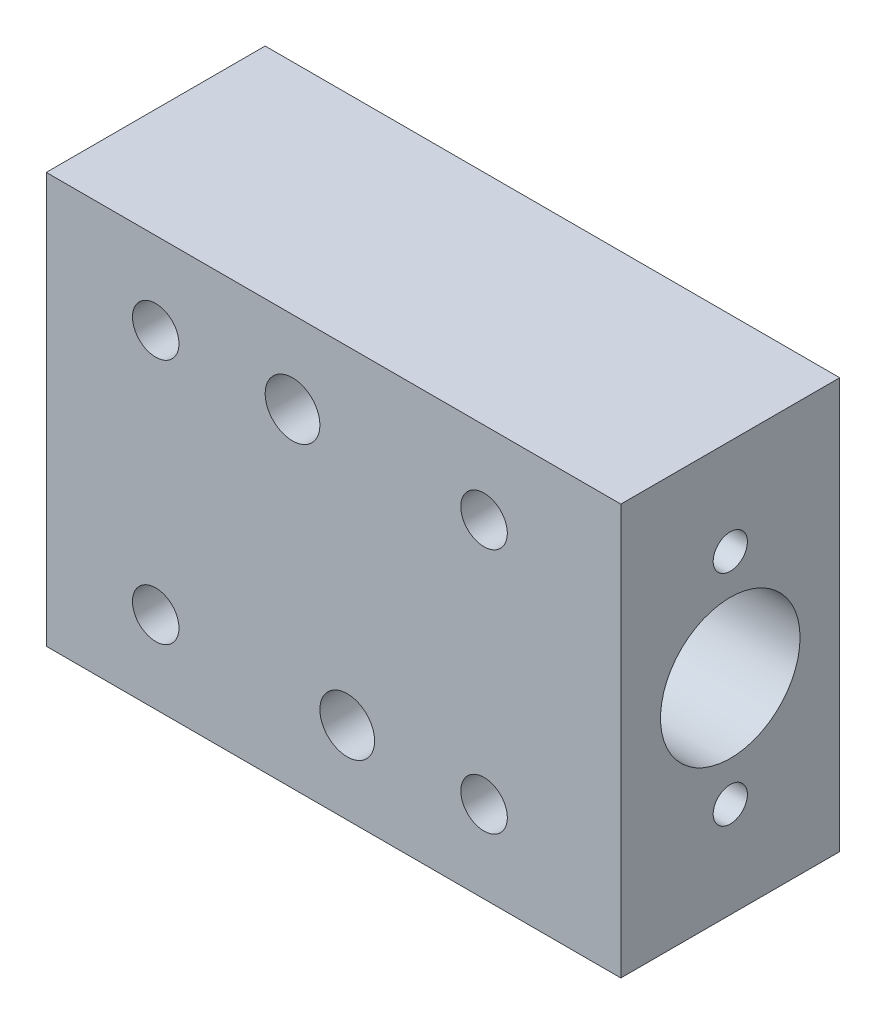
from build123d import *

# Parameters (mm, degrees)
CROQUIS1_W                                           = 42
CROQUIS1_H                                           = 30
SALIENTE_EXTRUIR1_DEPTH                              = 16
CROQUIS2_R                                           = 5.1
CORTAR_EXTRUIR1_DEPTH                                = 55.037024344
REFRENTADO_PARA_TORNILLO_CON_CABEZA_HUEC_D           = 3.4
REFRENTADO_PARA_TORNILLO_CON_CABEZA_HUEC_CBORE_D     = 6.5
REFRENTADO_PARA_TORNILLO_CON_CABEZA_HUEC_CBORE_DEPTH = 3.4
DI_METRO_DE_TALADRO_4_0_4_1_D                        = 4
CROQUIS7_R                                           = 1.25
CORTAR_EXTRUIR2_DEPTH                                = 7


with BuildPart() as part:
    # Croquis1 → Saliente-Extruir1 (new body)
    with BuildSketch(Plane.XY):
        with Locations((21, 15)):
            Rectangle(CROQUIS1_W, CROQUIS1_H)
    extrude(amount=SALIENTE_EXTRUIR1_DEPTH)

    # Croquis2 → Cortar-Extruir1 (cut, through all)
    with BuildSketch(Plane(origin=(42, 0, 0), x_dir=(0, 0, -1), z_dir=(1, 0, 0))):
        with Locations((-8, 15)):
            Circle(CROQUIS2_R)
    extrude(amount=-CORTAR_EXTRUIR1_DEPTH, mode=Mode.SUBTRACT)

    # Refrentado para tornillo con cabeza hueca de M31 (through all)
    with Locations(Plane(origin=(0, 0, 0), x_dir=(-1, 0, 0), z_dir=(0, 0, -1))):
        with Locations((-8, 6), (-32, 6), (-32, 24), (-8, 24)):
            CounterBoreHole(REFRENTADO_PARA_TORNILLO_CON_CABEZA_HUEC_D / 2, REFRENTADO_PARA_TORNILLO_CON_CABEZA_HUEC_CBORE_D / 2, REFRENTADO_PARA_TORNILLO_CON_CABEZA_HUEC_CBORE_DEPTH)

    # Diámetro de taladro Ø4.0 (4)1 (through all)
    with Locations(Plane(origin=(0, 0, 0), x_dir=(-1, 0, 0), z_dir=(0, 0, -1))):
        with Locations((-22, 6), (-18, 24)):
            Hole(DI_METRO_DE_TALADRO_4_0_4_1_D / 2)

    # Croquis7 → Cortar-Extruir2 (cut)
    with BuildSketch(Plane(origin=(42, 0, 0), x_dir=(0, 0, -1), z_dir=(1, 0, 0))):
        with Locations((-8, 23)):
            Circle(CROQUIS7_R)
        with Locations((-8, 7)):
            Circle(CROQUIS7_R)
    extrude(amount=-CORTAR_EXTRUIR2_DEPTH, mode=Mode.SUBTRACT)


solid = part.part
